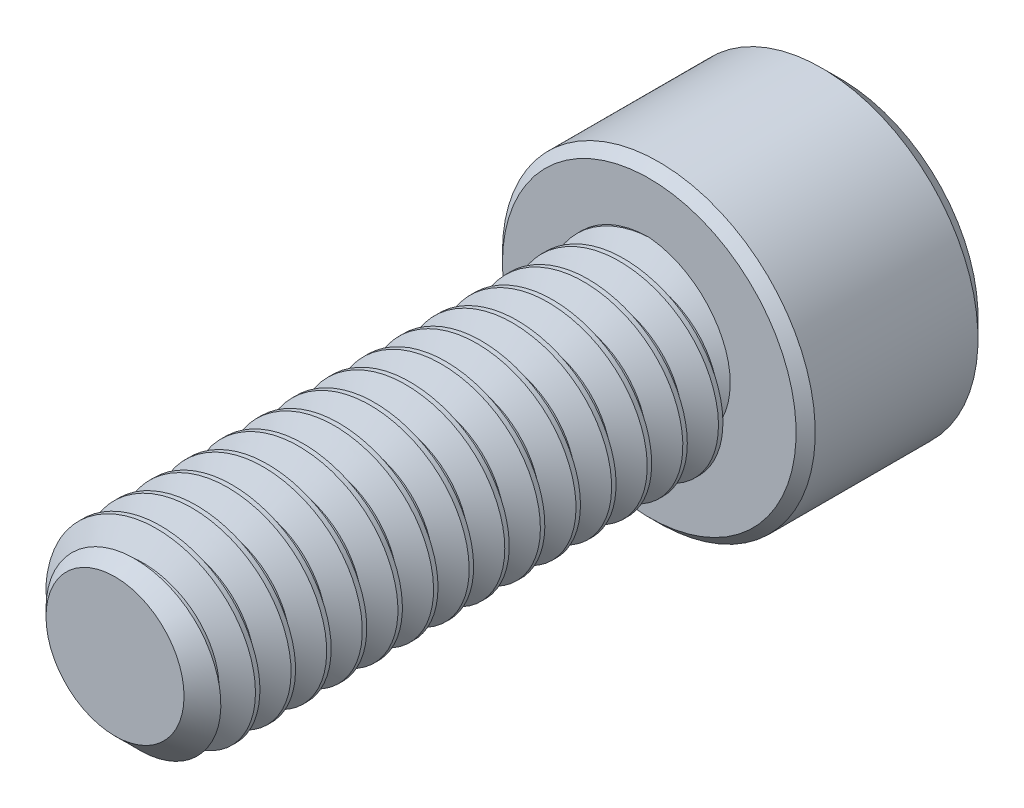
from build123d import *

# Parameters (mm, degrees)
SKETCH1_R          = 1.4224
EXTRUDE1_DEPTH     = 7.9375
CHAMFER3_SIZE      = 0.396875
CUT_SWEEP1_PITCH   = 0.529166667
SKETCH6_R          = 2.3241
EXTRUDE2_DEPTH     = 2.8448
CUT_EXTRUDE1_DEPTH = 1.7859375
SKETCH8_R          = 1.374815329
CUT_EXTRUDE2_DEPTH = 0.28448
CUT_EXTRUDE2_DRAFT = -45
CHAMFER1_SIZE      = 0.28448
CHAMFER2_SIZE      = 0.14224


with BuildPart() as part:
    # Sketch1 → Extrude1 (new body)
    with BuildSketch(Plane.XY):
        Circle(SKETCH1_R)
    extrude(amount=-EXTRUDE1_DEPTH)

    # Chamfer3
    chamfer3_edges = [part.edges().sort_by_distance(p)[0] for p in [
        (-1.4224, 0, 0),
    ]]
    chamfer(chamfer3_edges, length=CHAMFER3_SIZE)

    # Cut-Sweep1: the profile of Sketch3 profile screwed along a right-hand helix of 16 turns, 6 arcs to a turn; built about Z, then put on its axis
    cut_sweep1_z = Axis((0, 0, 0), (0, 0, 1))
    cut_sweep1_corners = [(1.4227, 0, -0.463194038), (1.078696168, 0, -0.264583333), (1.078696168, 0, -0.1984375), (1.4227, 0, 0.000173205)]
    with BuildLine(mode=Mode.PRIVATE) as cut_sweep1_profile:
        Line(cut_sweep1_corners[0], cut_sweep1_corners[1])
        Line(cut_sweep1_corners[1], cut_sweep1_corners[2])
        Line(cut_sweep1_corners[2], cut_sweep1_corners[3])
        Line(cut_sweep1_corners[3], cut_sweep1_corners[0])
    cut_sweep1_cap = Face(cut_sweep1_profile.wire())
    cut_sweep1_turn_angles = [0, 30, 60, 90, 120, 150, 180, 210, 240, 270, 300, 330, 360]
    cut_sweep1_turn_weights = [1, 0.8660254037844387, 1, 0.8660254037844387, 1, 0.8660254037844387, 1, 0.8660254037844387, 1, 0.8660254037844387, 1, 0.8660254037844387, 1]
    cut_sweep1_turn_rails = [Edge.make_bspline([Vector(p[0], p[1], 0).rotate(cut_sweep1_z, cut_sweep1_turn_angles[k]) / cut_sweep1_turn_weights[k] + Vector(0, 0, p[2] + CUT_SWEEP1_PITCH * cut_sweep1_turn_angles[k] / 360) for k in range(13)], [0, 0, 0, 1, 1, 2, 2, 3, 3, 4, 4, 5, 5, 6, 6, 6], 2, cut_sweep1_turn_weights) for p in cut_sweep1_corners]
    cut_sweep1_turn_sides = [Face.make_surface_from_curves(cut_sweep1_turn_rails[p[0]], cut_sweep1_turn_rails[p[1]]) for p in [(0, 1), (1, 2), (2, 3), (3, 0)]]
    cut_sweep1 = Plane(origin=(0, 0, 0), x_dir=(0, 1, 0), z_dir=(0, 0, -1)) * Solid(Shell([*[p.moved(Location((0, 0, CUT_SWEEP1_PITCH * i))) for i in range(16) for p in cut_sweep1_turn_sides], cut_sweep1_cap, cut_sweep1_cap.rotate(cut_sweep1_z, 5760).moved(Location((0, 0, CUT_SWEEP1_PITCH * 5760 / 360)))]))
    add(cut_sweep1, mode=Mode.SUBTRACT)

    # Sketch6 → Extrude2 (add)
    with BuildSketch(Plane(origin=(0, 0, -7.9375), x_dir=(-1, 0, 0), z_dir=(0, 0, -1))):
        Circle(SKETCH6_R)
    extrude(amount=EXTRUDE2_DEPTH)

    # Sketch7 → Cut-Extrude1 (cut)
    with BuildSketch(Plane(origin=(0, 0, -10.7823), x_dir=(-1, 0, 0), z_dir=(0, 0, -1))):
        Polygon((0, 1.374815329), (-1.190625, 0.687407664), (-1.190625, -0.687407664), (0, -1.374815329), (1.190625, -0.687407664), (1.190625, 0.687407664), align=None)
    extrude(amount=-CUT_EXTRUDE1_DEPTH, mode=Mode.SUBTRACT)


with BuildPart() as cut_extrude2_tool:
    # Sketch8 → Cut-Extrude2 (with draft: the straight prism first)
    with BuildSketch(Plane(origin=(0, 0, -10.7823), x_dir=(-1, 0, 0), z_dir=(0, 0, -1))):
        Circle(SKETCH8_R)
    extrude(amount=-CUT_EXTRUDE2_DEPTH)
    # Cut-Extrude2: the draft: its side faces are tilted about the plane it starts from
    cut_extrude2_sides = [cut_extrude2_tool.faces().sort_by_distance(p)[0] for p in [
        (1.374815329, 0, -10.64006),
    ]]
    draft(cut_extrude2_sides, Plane(origin=(0, 0, -10.7823), x_dir=(-1, 0, 0), z_dir=(0, 0, -1)), CUT_EXTRUDE2_DRAFT)


with BuildPart() as part_1:
    add(part.part)

    # Cut-Extrude2: cut by cut_extrude2_tool
    add(cut_extrude2_tool.part, mode=Mode.SUBTRACT)

    # Chamfer1
    chamfer1_edges = [part_1.edges().sort_by_distance(p)[0] for p in [
        (2.3241, 0, -10.7823),
    ]]
    chamfer(chamfer1_edges, length=CHAMFER1_SIZE)

    # Chamfer2
    chamfer2_edges = [part_1.edges().sort_by_distance(p)[0] for p in [
        (2.3241, 0, -7.9375),
    ]]
    chamfer(chamfer2_edges, length=CHAMFER2_SIZE)


solid = part_1.part
